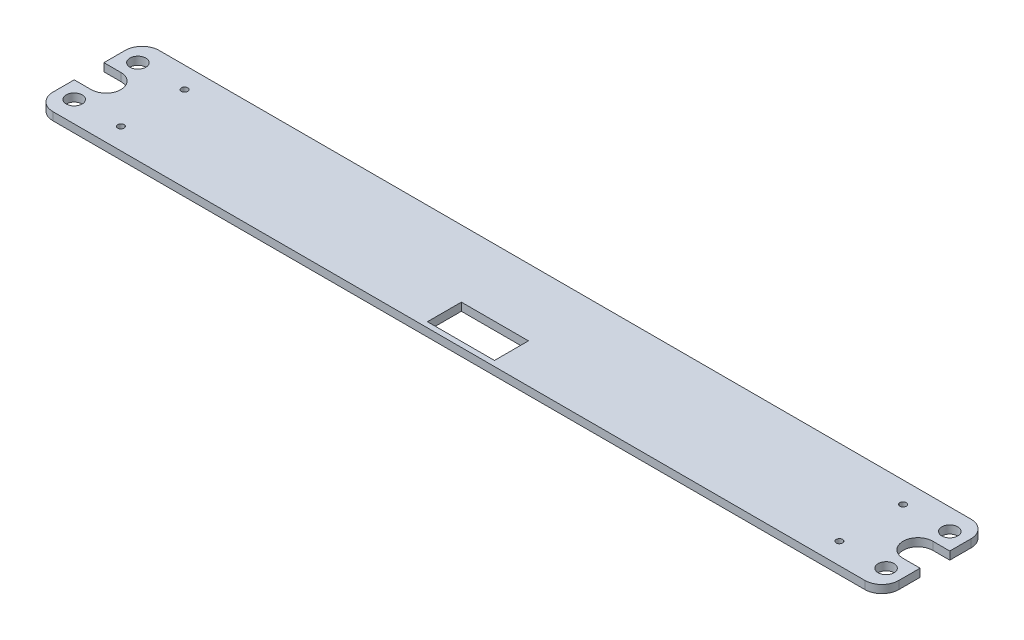
from build123d import *

# Parameters (mm, degrees)
SKETCH1_R           = 4.7625
SKETCH1_R_2         = 1.905
BOSS_EXTRUDE1_DEPTH = 4.7625
SKETCH2_W           = 40.132
SKETCH2_H           = 20.32
CUT_EXTRUDE1_DEPTH  = 511.085365827


with BuildPart() as part:
    # Sketch1 → Boss-Extrude1 (new body)
    with BuildSketch(Plane(origin=(0, 0, 0), x_dir=(1, 0, 0), z_dir=(0, 1, 0))):
        with BuildLine():
            Line((10.16, 0), (253.0475, 0))
            Line((253.0475, 0), (253.0475, -63.5))
            Line((253.0475, -63.5), (10.16, -63.5))
            ThreePointArc((10.16, -63.5), (2.975795103, -60.524204897), (0, -53.34))
            Line((0, -53.34), (0, -40.64))
            Line((0, -40.64), (10.16, -40.64))
            ThreePointArc((10.16, -40.64), (19.05, -31.75), (10.16, -22.86))
            Line((10.16, -22.86), (0, -22.86))
            Line((0, -22.86), (0, -10.16))
            ThreePointArc((0, -10.16), (2.975795103, -2.975795103), (10.16, 0))
        make_face()
        with Locations((10.16, -50.8)):
            Circle(SKETCH1_R, mode=Mode.SUBTRACT)
        with Locations((10.16, -12.7)):
            Circle(SKETCH1_R, mode=Mode.SUBTRACT)
        with Locations((38.1, -50.8)):
            Circle(SKETCH1_R_2, mode=Mode.SUBTRACT)
        with Locations((38.1, -12.7)):
            Circle(SKETCH1_R_2, mode=Mode.SUBTRACT)
    boss_extrude1 = extrude(amount=BOSS_EXTRUDE1_DEPTH)

    # Mirror1: Boss-Extrude1 across plane
    add(boss_extrude1.mirror(Plane(origin=(253.0475, 4.7625, 63.5), x_dir=(0, 0, 1), z_dir=(-1, 0, 0))))

    # Sketch2 → Cut-Extrude1 (cut, through all)
    with BuildSketch(Plane(origin=(0, 4.7625, 0), x_dir=(1, 0, 0), z_dir=(0, 1, 0))):
        with Locations((251.079, -50.165)):
            Rectangle(SKETCH2_W, SKETCH2_H)
    extrude(amount=-CUT_EXTRUDE1_DEPTH, mode=Mode.SUBTRACT)


solid = part.part
